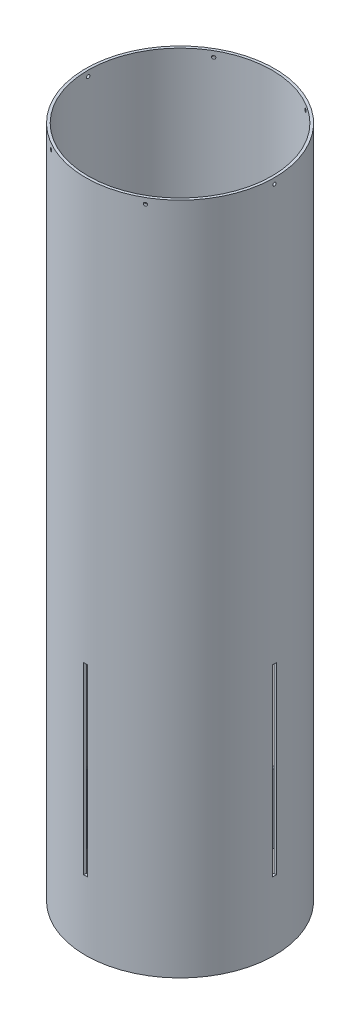
from build123d import *

# Parameters (mm, degrees)
SKETCH1_R           = 78.359
SKETCH1_R_2         = 76.2
BOSS_EXTRUDE1_DEPTH = 558.8
CUT_EXTRUDE1_DEPTH  = 570.682109393
CIRPATTERN1_COUNT   = 4
CUT_EXTRUDE2_DEPTH  = 570.682109393
CIRPATTERN2_COUNT   = 6
SKETCH3_R           = 3.175
CUT_EXTRUDE3_DEPTH  = 570.682109518


with BuildPart() as part:
    # Sketch1 → Boss-Extrude1 (new body)
    with BuildSketch(Plane(origin=(0, 0, 0), x_dir=(1, 0, 0), z_dir=(0, 1, 0))):
        Circle(SKETCH1_R)
        Circle(SKETCH1_R_2, mode=Mode.SUBTRACT)
    extrude(amount=BOSS_EXTRUDE1_DEPTH)

    # Sketch2 → Cut-Extrude1 (cut, through all)
    with BuildSketch(Plane(origin=(0, 0, 0), x_dir=(0, 0, -1), z_dir=(1, 0, 0))):
        Polygon((0, 57.15), (1.5875, 57.15), (1.5875, 209.55), (-1.5875, 209.55), (-1.5875, 57.15), align=None)
    cut_extrude1 = extrude(amount=-CUT_EXTRUDE1_DEPTH, mode=Mode.SUBTRACT)

    # CirPattern1: Cut-Extrude1 ×4 about axis
    cirpattern1_axis = Axis((0, 0, 0), (0, 1, 0))
    for i in range(1, CIRPATTERN1_COUNT):
        add(cut_extrude1.rotate(cirpattern1_axis, i * 360 / CIRPATTERN1_COUNT), mode=Mode.SUBTRACT)

    # Sketch2<3> → Cut-Extrude2 (cut, through all)
    with BuildSketch(Plane(origin=(0, 0, 0), x_dir=(0, 0, -1), z_dir=(1, 0, 0))):
        with BuildLine():
            ThreePointArc((0, 555.39005), (-0.956397277, 553.081102723), (1.35255, 554.0375))
            ThreePointArc((1.35255, 554.0375), (0.956397277, 554.993897277), (0, 555.39005))
        make_face()
    cut_extrude2 = extrude(amount=-CUT_EXTRUDE2_DEPTH, mode=Mode.SUBTRACT)

    # CirPattern2: Cut-Extrude2 ×6 about axis
    cirpattern2_axis = Axis((0, 558.8, 0), (0, -1, 0))
    for i in range(1, CIRPATTERN2_COUNT):
        add(cut_extrude2.rotate(cirpattern2_axis, i * 360 / CIRPATTERN2_COUNT), mode=Mode.SUBTRACT)

    # Sketch3 → Cut-Extrude3 (cut, through all)
    with BuildSketch(Plane(origin=(0, 0, 0), x_dir=(0.7071067811865477, 0, -0.7071067811865475), z_dir=(0.7071067811865475, 0, 0.7071067811865477))):
        with Locations((0, 127)):
            Circle(SKETCH3_R)
    extrude(amount=-CUT_EXTRUDE3_DEPTH, mode=Mode.SUBTRACT)


solid = part.part
